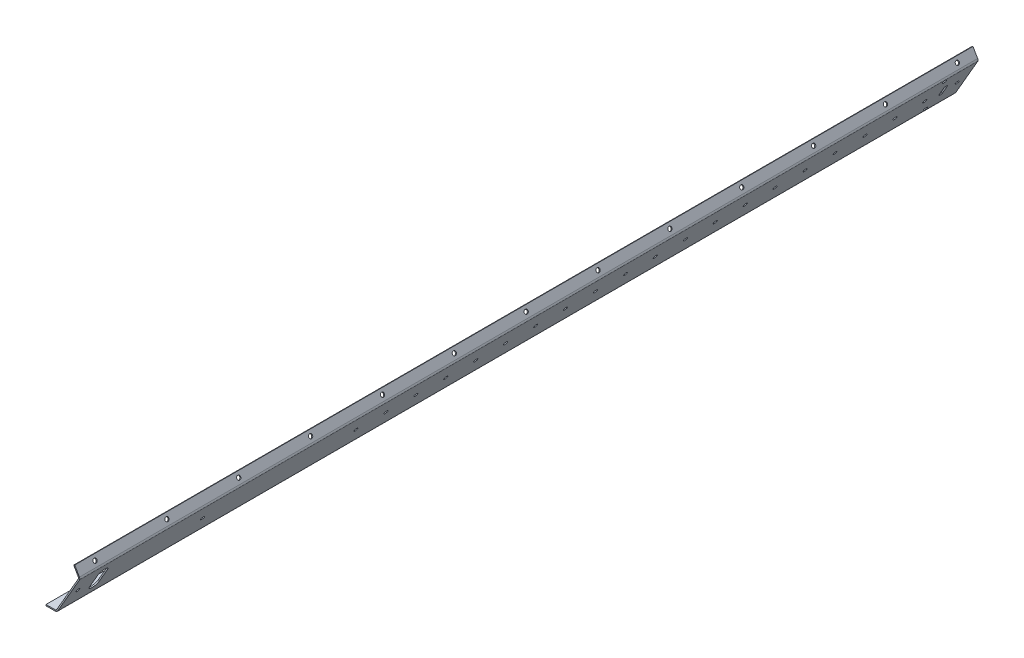
from build123d import *

# Parameters (mm, degrees)
SKETCH2_W           = 7.85
SKETCH2_H           = 1
BOSS_EXTRUDE2_DEPTH = 750
EDGE_FLANGE9_DEPTH  = 750
EDGE_FLANGE10_DEPTH = 750
SKETCH57_R          = 1.6
CUT_EXTRUDE2_DEPTH  = 10
SKETCH58_R          = 1.6
CUT_EXTRUDE3_DEPTH  = 10
SKETCH59_R          = 1.6
CUT_EXTRUDE4_DEPTH  = 10
SKETCH60_R          = 1.6
CUT_EXTRUDE5_DEPTH  = 3
CUT_EXTRUDE6_DEPTH  = 3
CUT_EXTRUDE7_DEPTH  = 10
SKETCH63_R          = 1.6
CUT_EXTRUDE8_DEPTH  = 10


# Sheet-metal steps are written as plain solids
with BuildPart() as part:
    # Sketch2 → Boss-Extrude2 (new body)
    with BuildSketch(Plane.XY):
        with Locations((-96.082096866, 298.73456983)):
            Rectangle(SKETCH2_W, SKETCH2_H)
    extrude(amount=BOSS_EXTRUDE2_DEPTH)

    # Edge-Flange9 section (across the edge) → Edge-Flange9 (add)
    with BuildSketch(Plane(origin=(-91.52201157, 299.23456983, 750), x_dir=(-0.8660254037844364, 0.5000000000000041, 0), z_dir=(0, 0, -1))):
        with BuildLine():
            Line((-1, 0.635085296), (-1, 37.112649731))
            Line((-1, 37.112649731), (0, 37.112649731))
            Line((0, 37.112649731), (0, 0.635085296))
            ThreePointArc((0, 0.635085296), (0.147372056, 0.085085296), (0.55, -0.317542648))
            Line((0.55, -0.317542648), (0.05, -1.183568052))
            ThreePointArc((0.05, -1.183568052), (-0.718653348, -0.414914704), (-1, 0.635085296))
        make_face()
    extrude(amount=EDGE_FLANGE9_DEPTH)

    # Edge-Flange10 section (across the edge) → Edge-Flange10 (add)
    with BuildSketch(Plane(origin=(-72.648144057, 331.925067298, 750), x_dir=(-0.8660254037844433, -0.49999999999999195, 0), z_dir=(0, 0, -1))):
        with BuildLine():
            Line((-1, 0.635085296), (-1, 8.49))
            Line((-1, 8.49), (0, 8.49))
            Line((0, 8.49), (0, 0.635085296))
            ThreePointArc((0, 0.635085296), (0.147372056, 0.085085296), (0.55, -0.317542648))
            Line((0.55, -0.317542648), (0.05, -1.183568052))
            ThreePointArc((0.05, -1.183568052), (-0.718653348, -0.414914704), (-1, 0.635085296))
        make_face()
    extrude(amount=EDGE_FLANGE10_DEPTH)

    # Sketch57 → Cut-Extrude2 (cut)
    with BuildSketch(Plane.XZ.offset(-298.23456983)):
        with Locations(Location((-96.082096866, 735, 0), (0, 0, 270))):
            Circle(SKETCH57_R)
        with Locations(Location((-96.082096866, 15, 0), (0, 0, 270))):
            Circle(SKETCH57_R)
        with Locations(Location((-96.082096866, 75, 0), (0, 0, 270))):
            Circle(SKETCH57_R)
        with Locations(Location((-96.082096866, 135, 0), (0, 0, 270))):
            Circle(SKETCH57_R)
        with Locations(Location((-96.082096866, 195, 0), (0, 0, 270))):
            Circle(SKETCH57_R)
        with Locations(Location((-96.082096866, 255, 0), (0, 0, 270))):
            Circle(SKETCH57_R)
        with Locations(Location((-96.082096866, 315, 0), (0, 0, 270))):
            Circle(SKETCH57_R)
        with Locations(Location((-96.082096866, 375, 0), (0, 0, 270))):
            Circle(SKETCH57_R)
        with Locations(Location((-96.082096866, 435, 0), (0, 0, 270))):
            Circle(SKETCH57_R)
        with Locations(Location((-96.082096866, 495, 0), (0, 0, 270))):
            Circle(SKETCH57_R)
        with Locations(Location((-96.082096866, 555, 0), (0, 0, 270))):
            Circle(SKETCH57_R)
        with Locations(Location((-96.082096866, 615, 0), (0, 0, 270))):
            Circle(SKETCH57_R)
        with Locations(Location((-96.082096866, 675, 0), (0, 0, 270))):
            Circle(SKETCH57_R)
    extrude(amount=-CUT_EXTRUDE2_DEPTH, mode=Mode.SUBTRACT)

    # Sketch58 → Cut-Extrude3 (cut)
    with BuildSketch(Plane(origin=(90.107687578, 52.023697679, 0), x_dir=(0, 0, -1), z_dir=(0.8660254037844434, 0.4999999999999918, 0))):
        with Locations(Location((-735, 328.34215511, 0), (0, 0, 90))):
            Circle(SKETCH58_R)
        with Locations(Location((-15, 328.34215511, 0), (0, 0, 90))):
            Circle(SKETCH58_R)
        with Locations(Location((-75, 328.34215511, 0), (0, 0, 90))):
            Circle(SKETCH58_R)
        with Locations(Location((-135, 328.34215511, 0), (0, 0, 90))):
            Circle(SKETCH58_R)
        with Locations(Location((-195, 328.34215511, 0), (0, 0, 90))):
            Circle(SKETCH58_R)
        with Locations(Location((-255, 328.34215511, 0), (0, 0, 90))):
            Circle(SKETCH58_R)
        with Locations(Location((-315, 328.34215511, 0), (0, 0, 90))):
            Circle(SKETCH58_R)
        with Locations(Location((-375, 328.34215511, 0), (0, 0, 90))):
            Circle(SKETCH58_R)
        with Locations(Location((-435, 328.34215511, 0), (0, 0, 90))):
            Circle(SKETCH58_R)
        with Locations(Location((-495, 328.34215511, 0), (0, 0, 90))):
            Circle(SKETCH58_R)
        with Locations(Location((-555, 328.34215511, 0), (0, 0, 90))):
            Circle(SKETCH58_R)
        with Locations(Location((-615, 328.34215511, 0), (0, 0, 90))):
            Circle(SKETCH58_R)
        with Locations(Location((-675, 328.34215511, 0), (0, 0, 90))):
            Circle(SKETCH58_R)
    extrude(amount=-CUT_EXTRUDE3_DEPTH, mode=Mode.SUBTRACT)

    # Sketch59 → Cut-Extrude4 (cut)
    with BuildSketch(Plane(origin=(-198.213878259, 114.43883597, 0), x_dir=(0, 0, 1), z_dir=(-0.8660254037844364, 0.5000000000000041, 0))):
        with Locations(Location((35, 232.257600891, 0), (0, 0, 270))):
            Circle(SKETCH59_R)
        with Locations(Location((60, 232.257600891, 0), (0, 0, 270))):
            Circle(SKETCH59_R)
        with Locations(Location((85, 232.257600891, 0), (0, 0, 270))):
            Circle(SKETCH59_R)
        with Locations(Location((110, 232.257600891, 0), (0, 0, 270))):
            Circle(SKETCH59_R)
        with Locations(Location((135, 232.257600891, 0), (0, 0, 270))):
            Circle(SKETCH59_R)
        with Locations(Location((160, 232.257600891, 0), (0, 0, 270))):
            Circle(SKETCH59_R)
        with Locations(Location((185, 232.257600891, 0), (0, 0, 270))):
            Circle(SKETCH59_R)
        with Locations(Location((210, 232.257600891, 0), (0, 0, 270))):
            Circle(SKETCH59_R)
        with Locations(Location((235, 232.257600891, 0), (0, 0, 270))):
            Circle(SKETCH59_R)
        with Locations(Location((260, 232.257600891, 0), (0, 0, 270))):
            Circle(SKETCH59_R)
        with Locations(Location((285, 232.257600891, 0), (0, 0, 270))):
            Circle(SKETCH59_R)
        with Locations(Location((310, 232.257600891, 0), (0, 0, 270))):
            Circle(SKETCH59_R)
        with Locations(Location((335, 232.257600891, 0), (0, 0, 270))):
            Circle(SKETCH59_R)
        with Locations(Location((360, 232.257600891, 0), (0, 0, 270))):
            Circle(SKETCH59_R)
        with Locations(Location((385, 232.257600891, 0), (0, 0, 270))):
            Circle(SKETCH59_R)
        with Locations(Location((410, 232.257600891, 0), (0, 0, 270))):
            Circle(SKETCH59_R)
        with Locations(Location((435, 232.257600891, 0), (0, 0, 270))):
            Circle(SKETCH59_R)
        with Locations(Location((460, 232.257600891, 0), (0, 0, 270))):
            Circle(SKETCH59_R)
        with Locations(Location((485, 232.257600891, 0), (0, 0, 270))):
            Circle(SKETCH59_R)
        with Locations(Location((510, 232.257600891, 0), (0, 0, 270))):
            Circle(SKETCH59_R)
    extrude(amount=-CUT_EXTRUDE4_DEPTH, mode=Mode.SUBTRACT)

    # Sketch60 → Cut-Extrude5 (cut)
    with BuildSketch(Plane(origin=(-198.213878259, 114.43883597, 0), x_dir=(0, 0, 1), z_dir=(-0.8660254037844364, 0.5000000000000041, 0))):
        with Locations(Location((26.5, 248.107600891, 0), (0, 0, 270))):
            Circle(SKETCH60_R)
        with Locations(Location((26.5, 216.407600891, 0), (0, 0, 270))):
            Circle(SKETCH60_R)
    extrude(amount=-CUT_EXTRUDE5_DEPTH, mode=Mode.SUBTRACT)

    # Sketch61 → Cut-Extrude6 (cut)
    with BuildSketch(Plane(origin=(-198.213878259, 114.43883597, 0), x_dir=(0, 0, 1), z_dir=(-0.8660254037844364, 0.5000000000000041, 0))):
        with BuildLine():
            Line((21.25, 236.757600891), (21.25, 227.757600891))
            ThreePointArc((21.25, 227.757600891), (21.103553391, 227.404047501), (20.75, 227.257600891))
            Line((20.75, 227.257600891), (18.75, 227.257600891))
            ThreePointArc((18.75, 227.257600891), (18.396446609, 227.404047501), (18.25, 227.757600891))
            Line((18.25, 227.757600891), (18.25, 236.757600891))
            ThreePointArc((18.25, 236.757600891), (18.396446609, 237.111154282), (18.75, 237.257600891))
            Line((18.75, 237.257600891), (20.75, 237.257600891))
            ThreePointArc((20.75, 237.257600891), (21.103553391, 237.111154282), (21.25, 236.757600891))
        make_face()
    extrude(amount=-CUT_EXTRUDE6_DEPTH, mode=Mode.SUBTRACT)

    # Sketch62 → Cut-Extrude7 (cut)
    with BuildSketch(Plane(origin=(-198.213878259, 114.43883597, 0), x_dir=(0, 0, 1), z_dir=(-0.8660254037844364, 0.5000000000000041, 0))):
        with BuildLine():
            Line((729, 239.257600891), (729, 225.257600891))
            ThreePointArc((729, 225.257600891), (725, 221.257600891), (721, 225.257600891))
            Line((721, 225.257600891), (721, 239.257600891))
            ThreePointArc((721, 239.257600891), (725, 243.257600891), (729, 239.257600891))
        make_face()
    extrude(amount=-CUT_EXTRUDE7_DEPTH, mode=Mode.SUBTRACT)

    # Sketch63 → Cut-Extrude8 (cut)
    with BuildSketch(Plane(origin=(-198.213878259, 114.43883597, 0), x_dir=(0, 0, 1), z_dir=(-0.8660254037844364, 0.5000000000000041, 0))):
        with Locations(Location((8, 232.257600891, 0), (0, 0, 270))):
            Circle(SKETCH63_R)
        with Locations(Location((638, 232.257600891, 0), (0, 0, 270))):
            Circle(SKETCH63_R)
        with Locations(Location((742, 232.257600891, 0), (0, 0, 270))):
            Circle(SKETCH63_R)
    extrude(amount=-CUT_EXTRUDE8_DEPTH, mode=Mode.SUBTRACT)


solid = part.part
